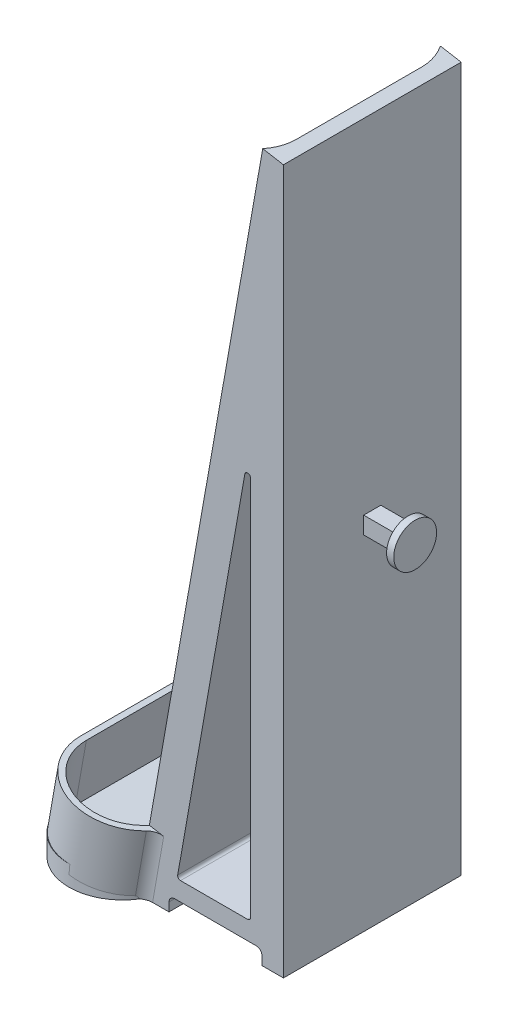
from build123d import *

# Parameters (mm, degrees)
BOSS_EXTRUDE1_DEPTH   = 3.175
BOSS_EXTRUDE2_START   = -3.175
BOSS_EXTRUDE2_DEPTH   = 11.112499999999999
BODY_MOVE_COPY2_ANGLE = 90.0000000000002
BOSS_EXTRUDE5_START   = -3.175
BOSS_EXTRUDE5_DEPTH   = 127
BOSS_EXTRUDE7_DEPTH   = 3.622257574
CUT_EXTRUDE1_START    = -11.112499999999999
CUT_EXTRUDE1_DEPTH    = 11.112499999999999
CUT_EXTRUDE4_REACH    = 131.332
LOFT1_START           = -15.77975
LOFT1_DEPTH           = 31.5595
CUT_EXTRUDE5_DEPTH    = 1.27
CUT_EXTRUDE6_DEPTH    = 133.79321580314624
FILLET2_R             = 0.508
CUT_EXTRUDE7_DEPTH    = 133.79321580314624
FILLET3_R             = 2.54
BOSS_EXTRUDE9_DEPTH   = 7.619999999999999
SKETCH20_R            = 3.81
BOSS_EXTRUDE10_DEPTH  = 1.27


with BuildPart() as part:
    # Sketch4 → Boss-Extrude1 (new body)
    with BuildSketch(Plane(origin=(0, 0, 0), x_dir=(0.984807753012208, -0.17364817766693072, 0), z_dir=(0.17364817766693072, 0.984807753012208, 0))):
        with BuildLine():
            Line((0, -8.731249999999998), (-22.225, -8.731249999999998))
            ThreePointArc((-22.225, -8.731249999999998), (-30.956249999999997, -1.63e-15), (-22.225000000000005, 8.73124999999999))
            Line((-22.225000000000005, 8.73124999999999), (1.71e-15, 8.73125))
            ThreePointArc((1.71e-15, 8.73125), (8.731249999999998, 0), (0, -8.731249999999998))
        make_face()
    extrude(amount=BOSS_EXTRUDE1_DEPTH)

    # Sketch5 → Boss-Extrude2 (add)
    with BuildSketch(Plane(origin=(0.5513329640925053, 3.1267646158137623, 0), x_dir=(0.9848077530122081, -0.17364817766693072, 0), z_dir=(0.17364817766693072, 0.9848077530122081, 0)).offset(BOSS_EXTRUDE2_START)):
        with BuildLine():
            Line((1.57e-15, 9.74725), (-22.225000000000005, 9.74724999999999))
            ThreePointArc((-22.225000000000005, 9.74724999999999), (-31.97225, -1.51e-15), (-22.225, -9.747249999999998))
            Line((-22.225, -9.747249999999998), (1.79e-15, -9.74725))
            ThreePointArc((1.79e-15, -9.74725), (9.74725, 2.16e-15), (1.57e-15, 9.74725))
        make_face()
        with BuildLine():
            Line((5.3e-16, 8.73125), (-22.225000000000005, 8.73124999999999))
            ThreePointArc((-22.225000000000005, 8.73124999999999), (-30.956249999999997, -1.63e-15), (-22.225000000000005, -8.731249999999998))
            Line((-22.225000000000005, -8.731249999999998), (-1.6e-15, -8.73125))
            ThreePointArc((-1.6e-15, -8.73125), (8.73125, -1.94e-15), (5.3e-16, 8.73125))
        make_face(mode=Mode.SUBTRACT)
    extrude(amount=BOSS_EXTRUDE2_DEPTH)


with BuildPart() as part_1:
    # Body-Move/Copy2: moved
    add(part.part.moved(Location((5e-17, 2.8e-16, 0))).rotate(Axis((-10.943676155348163, 1.9296653743237675, 1.73e-15), (0.1736481776669307, 0.984807753012208, 0)), BODY_MOVE_COPY2_ANGLE))

    # Sketch6 → Boss-Extrude5 (add)
    with BuildSketch(Plane(origin=(0.5513329640925054, 3.1267646158137636, -9e-17), x_dir=(0.9848077530122081, -0.1736481776669307, 0), z_dir=(0.1736481776669307, 0.9848077530122081, 0)).offset(BOSS_EXTRUDE5_START)):
        with BuildLine():
            Line((4.4e-16, 15.779750000000002), (-2.5553006918151486, 15.779750000000002))
            ThreePointArc((-2.5553006918151517, 15.77975), (-1.6674472336253352, 13.520790016359634), (-1.3652500000000423, 11.112500000000036))
            Line((-1.3652500000000418, 11.112500000000034), (-1.3652499999999672, -11.11250000000001))
            ThreePointArc((-1.3652499999999694, -11.112500000000013), (-1.667447233625257, -13.520790016359623), (-2.5553006918150736, -15.77975))
            Line((-2.555300691815072, -15.779750000000002), (4.49e-15, -15.779750000000002))
            Line((-1.1e-16, -15.77975), (-1.1e-16, 15.779750000000002))
        make_face()
        with BuildLine():
            ThreePointArc((-1.3652500000000423, 11.112500000000036), (-1.6674472336253352, 13.520790016359634), (-2.5553006918151517, 15.77975))
            Line((-2.5553006918151486, 15.779750000000002), (-3.733373764462396, 15.779750000000002))
            ThreePointArc((-3.7333737644623968, 15.77975), (-2.7260906817477455, 13.54208130327656), (-2.381250000000044, 11.11250000000003))
            Line((-2.3812500000000436, 11.112500000000027), (-2.381249999999966, -11.112499999999974))
            ThreePointArc((-2.3812499999999677, -11.112499999999974), (-2.7260906817476602, -13.542081303276534), (-3.7333737644623177, -15.779750000000003))
            Line((-3.7333737644623204, -15.779750000000002), (-2.555300691815072, -15.779750000000002))
            ThreePointArc((-2.5553006918150736, -15.77975), (-1.667447233625257, -13.520790016359623), (-1.3652499999999694, -11.112500000000013))
            Line((-1.3652499999999672, -11.11250000000001), (-1.3652500000000418, 11.112500000000034))
        make_face()
    extrude(amount=BOSS_EXTRUDE5_DEPTH)


with BuildPart() as boss_extrude7_tool:
    # Boss-Extrude7: read off the stored shape, not the designer's step
    # Boss-Extrude7 outline → Boss-Extrude7 (new body)
    with BuildSketch(Plane(origin=(0, 0, 0), x_dir=(1, 0, 0), z_dir=(0, 1, 0))):
        with BuildLine():
            Line((22.053318564, 15.77975), (-2.516479933, 15.77975))
            add(Edge.make_bspline(
                [(-2.516479933, 15.77975), (-6.087914144025663, 22.428833371813603), (-13.315378834961066, 20.557552766374705), (-20.54284352589647, 18.686272160935808), (-20.542843526, 11.1125)],
                knots=[2.070114834496927, 2.070114834496927, 2.070114834496927, 3.3912519074408096, 3.3912519074408096, 4.712388980384692, 4.712388980384692, 4.712388980384692], degree=2, weights=[1, 0.7896435245481747, 1, 0.7896435245481747, 1]))
            Line((-20.542843526, 11.1125), (-20.542843526, -11.1125))
            add(Edge.make_bspline(
                [(-20.542843526, -11.1125), (-20.542843525896345, -18.68627216093585), (-13.315378834960956, -20.557552766374716), (-6.08791414402557, -22.428833371813585), (-2.516479933, -15.77975)],
                knots=[4.712388980384692, 4.712388980384692, 4.712388980384692, 6.033526053328573, 6.033526053328573, 7.354663126272453, 7.354663126272453, 7.354663126272453], degree=2, weights=[1, 0.7896435245481753, 1, 0.7896435245481753, 1]))
            Line((-2.516479933, -15.77975), (22.053318564, -15.77975))
            Line((22.053318564, -15.77975), (22.053318564, 15.77975))
        make_face()
    extrude(amount=BOSS_EXTRUDE7_DEPTH)


with BuildPart() as part_2:
    add(part_1.part)


with BuildPart() as part_3:
    # Boss-Extrude7: joined with boss_extrude7_tool
    add(part_2.part.fuse(boss_extrude7_tool.part, tol=0.00001))

    # Sketch8 → Cut-Extrude1 (cut)
    with BuildSketch(Plane(origin=(1.929665374323769, 10.943676155348173, 0), x_dir=(0.9848077530122081, -0.17364817766693075, 0), z_dir=(0.17364817766693075, 0.9848077530122081, 0)).offset(CUT_EXTRUDE1_START)):
        with BuildLine():
            ThreePointArc((-3.7333737644623213, -15.779750000000003), (-3.2397646593705955, -14.88804828056871), (-2.853430222713813, -13.944900567790237))
            Line((-2.8534302227138113, -13.944900567790235), (-2.853430222713809, 13.94490056779))
            ThreePointArc((-2.8534302227138095, 13.94490056779), (-3.2397646593706177, 14.888048280568597), (-3.7333737644623985, 15.779750000000003))
            ThreePointArc((-3.7333737644623985, 15.779750000000003), (-13.542081303276605, 19.498909318252295), (-19.843750000000043, 11.112499999999972))
            Line((-19.843750000000046, 11.112499999999972), (-19.843749999999957, -11.112500000000043))
            ThreePointArc((-19.843749999999957, -11.112500000000042), (-13.54208130327649, -19.498909318252302), (-3.7333737644623213, -15.779750000000003))
        make_face()
    extrude(amount=CUT_EXTRUDE1_DEPTH, mode=Mode.SUBTRACT)

    # Sketch9 → Cut-Extrude4 (cut, up to next)
    with BuildSketch(Plane(origin=(0, 0, 0), x_dir=(0.9848077530122081, -0.17364817766693072, 0), z_dir=(0.17364817766693072, 0.9848077530122081, 0)), mode=Mode.PRIVATE) as cut_extrude4_sk1:
        with BuildLine():
            Line((-2.3812500000174737, -11.112499999999976), (-2.3812500000295542, 11.112500000000031))
            ThreePointArc((-2.3812500000295542, 11.112500000000031), (-2.500104004853256, 12.54824433126907), (-2.853430222713811, 13.944900567789999))
            Line((-2.853430222713811, 13.944900567789999), (-2.8534302227138113, -13.944900567790238))
            ThreePointArc((-2.8534302227138113, -13.944900567790238), (-2.500104004825662, -12.548244331273757), (-2.3812500000174737, -11.112499999999976))
        make_face()
    cut_extrude4_tool1 = extrude(cut_extrude4_sk1.sketch, amount=CUT_EXTRUDE4_REACH, mode=Mode.PRIVATE) & part_3.part
    add(cut_extrude4_tool1.solids().sort_by_distance((-2.584299, 0.455682, 0))[0], mode=Mode.SUBTRACT)

    # Loft1: read off the stored shape, not the designer's step
    # Loft1 outline → Loft1 (add)
    with BuildSketch(Plane.XY.offset(LOFT1_START)):
        Polygon((0.638701741, 3.622257574), (22.053318564, 3.622257574), (22.053318564, 125.070584633), align=None)
    extrude(amount=LOFT1_DEPTH)

    # Sketch12 → Cut-Extrude5 (cut)
    with BuildSketch(Plane(origin=(-2.345073461860326, 0.4134997230693797, 8.13e-15), x_dir=(3.36e-15, -5.9e-16, 1), z_dir=(-0.9848077530122081, 0.17364817766693072, 3.4134285390241548e-15))):
        with BuildLine():
            Line((-5.228221385273689, 114.22616766869933), (-0.12014507933680221, 114.22616766869933))
            add(Edge.make_bspline(
                [(-0.12014507933680221, 114.22616766869933), (0.07011968746962734, 114.22366909294938), (0.4411432164598798, 114.21879677524308), (0.9827741836600262, 114.17779062534875), (1.494126462329712, 114.10940638067792), (1.976272538251337, 114.0201107238905), (2.4258159831780612, 113.8958508526396), (2.846789640496429, 113.75076106159327), (3.2364123180406654, 113.57537489061744), (3.476580661151348, 113.43401615220935), (3.59407848992688, 113.36485905753871)],
                knots=[0, 0, 0, 0, 1.182376437119959, 2.305679005411862, 3.373202861573748, 4.38770938204811, 5.350376953479489, 6.268953384896463, 7.153118116444824, 8, 8, 8, 8], degree=3))
            add(Edge.make_bspline(
                [(3.59407848992688, 113.36485905753871), (3.7378787021642528, 113.26859900310113), (4.018252781224821, 113.08091621951313), (4.388442547868716, 112.74844804018409), (4.701416531623982, 112.38382962893776), (4.959695904779897, 111.98831066442631), (5.156117661939543, 111.55891716025648), (5.297432419351558, 111.1005637999526), (5.387891930540603, 110.61058984670753), (5.3965078564153615, 110.27234488132945), (5.400924630058811, 110.09895069597692)],
                knots=[0, 0, 0, 0, 1.0604796362436606, 2.067667333365926, 3.040862740220127, 4.0009023693274575, 4.955444635567215, 5.9271800263127785, 6.937412326837788, 8, 8, 8, 8], degree=3))
            add(Edge.make_bspline(
                [(5.400924630058811, 110.09895069597692), (5.397493058523768, 109.94376899276502), (5.3907923093439525, 109.64074932381718), (5.316867296627098, 109.20084612163079), (5.204149909546891, 108.78836521305224), (5.045292694282028, 108.40215934170175), (4.8378643415488884, 108.04538379924806), (4.583775694978403, 107.71622832331954), (4.287937265399445, 107.41091639148242), (4.058499321138568, 107.23855837370101), (3.9418624086289658, 107.15093857260379)],
                knots=[0, 0, 0, 0, 1.0854956756165175, 2.1196219236003433, 3.1134599711837283, 4.0743661896149845, 5.034707347550299, 5.993519082000086, 6.979986767058713, 8, 8, 8, 8], degree=3))
            add(Edge.make_bspline(
                [(3.9418624086289658, 107.15093857260379), (3.8674061020696757, 107.10088467302324), (3.7115153425793963, 106.99608575427958), (3.4527062359864646, 106.85561854380855), (3.1610901044496735, 106.72655205210827), (2.8385879725396244, 106.60485385068067), (2.486635569748659, 106.48730233965028), (2.1011619316461143, 106.38357058470808), (1.6861022595943742, 106.28087750946315), (1.3962794538586694, 106.22573847793748), (1.246537038687801, 106.19724985803789)],
                knots=[0, 0, 0, 0, 0.7474757140938376, 1.5650058692857316, 2.4502682500189836, 3.403591130996996, 4.437214553887347, 5.541548615613701, 6.729794755303424, 8, 8, 8, 8], degree=3))
            Line((1.246537038687801, 106.19724985803789), (1.246537038687801, 106.13475743514613))
            add(Edge.make_bspline(
                [(1.246537038687801, 106.13475743514613), (1.3660718402415537, 106.09071887952346), (1.6042519967499904, 106.00296945480137), (1.9468078176663832, 105.83231695525419), (2.272230351154713, 105.62779767822659), (2.5841780822657423, 105.39252783143037), (2.8810909309636, 105.12492533590407), (3.163673559657734, 104.82445574826548), (3.4344208083879644, 104.49333631807275), (3.596003402073053, 104.2523268186339), (3.6783074077375413, 104.12956577887941)],
                knots=[0, 0, 0, 0, 0.9509700540078693, 1.894864034191553, 2.852141104007893, 3.818150398457251, 4.809710567344614, 5.833759715287508, 6.896599883703487, 8, 8, 8, 8], degree=3))
            add(Edge.make_bspline(
                [(3.6783074077375413, 104.12956577887941), (3.775692600347029, 103.97408233985871), (3.979602254489536, 103.64852387017702), (4.2885028949926935, 103.13363510666991), (4.612027836066335, 102.56837441845246), (4.953795517003646, 101.9567395283279), (5.308731303043535, 101.29540349015345), (5.682472577026052, 100.58790380717947), (6.0694581075513865, 99.83080584339513), (6.331407875788347, 99.30876421533503), (6.466012881083948, 99.04050890599655)],
                knots=[0, 0, 0, 0, 0.7584941997821967, 1.5881704990499537, 2.482219144382332, 3.451093378059206, 4.484786460106584, 5.585221915356614, 6.759146766730135, 8, 8, 8, 8], degree=3))
            Line((6.466012881083948, 99.04050890599655), (4.346704626493113, 99.04050890599655))
            add(Edge.make_bspline(
                [(4.346704626493113, 99.04050890599655), (4.277356486192602, 99.20008226398323), (4.141116467962076, 99.51357700381334), (3.933941220184338, 99.97207322371179), (3.733535252246594, 100.41163643016142), (3.5386164470888235, 100.83086630514678), (3.34464723776627, 101.22755296425665), (3.1571473476643748, 101.60521553155496), (2.9764923498675473, 101.96418752150187), (2.7965282612002222, 102.3003469576902), (2.6228873824530443, 102.61713813313123), (2.4510721009562677, 102.91245986763002), (2.2873337607202027, 103.1890726898358), (2.124915748817319, 103.44382624931505), (1.9689717279499828, 103.6790023444885), (1.8167463558670436, 103.89373327881812), (1.670093961641272, 104.08855646111223), (1.5694830719355621, 104.20787414422202), (1.5209602870386663, 104.26541887212241)],
                knots=[0, 0, 0, 0, 1.4018530954257313, 2.7540535398598456, 4.053703774180958, 5.29423820197095, 6.478936837861934, 7.611353305162164, 8.691569836876138, 9.716620789310689, 10.683390878219486, 11.60209260650502, 12.46936221612508, 13.273055428587995, 14.03606427660493, 14.742693929439772, 15.393624366211194, 16, 16, 16, 16], degree=3))
            add(Edge.make_bspline(
                [(1.5209602870386663, 104.26541887212241), (1.4190542612158992, 104.37546577264021), (1.2174884622533795, 104.59313387663241), (0.8788604577850404, 104.87690606734962), (0.5137419428527865, 105.11421238931482), (0.1269062745209998, 105.31257173612752), (-0.28672510091762743, 105.46039470190755), (-0.722246339159558, 105.57045903530886), (-1.1832155194799538, 105.63649932804356), (-1.4992911336278083, 105.64437900547513), (-1.6607191567124484, 105.64840336133616)],
                knots=[0, 0, 0, 0, 1.0037135747502297, 1.9853029003006932, 2.9492317428411914, 3.914876407151171, 4.889583371749836, 5.883999607408954, 6.91930365731249, 8, 8, 8, 8], degree=3))
            Line((-1.6607191567124484, 105.64840336133616), (-3.5028871010875595, 105.64840336133616))
            Line((-3.5028871010875595, 105.64840336133616), (-3.5028871010875595, 99.04050890599655))
            Line((-3.5028871010875595, 99.04050890599655), (-5.228221385273689, 99.04050890599655))
            Line((-5.228221385273689, 99.04050890599655), (-5.228221385273689, 114.22616766869933))
        make_face()
        with BuildLine():
            Line((-3.5028871010875595, 112.77797369472893), (-3.5028871010875595, 107.04225609800937))
            Line((-3.5028871010875595, 107.04225609800937), (-0.7233328133357322, 107.04225609800937))
            add(Edge.make_bspline(
                [(-0.7233328133357322, 107.04225609800937), (-0.5656930761106643, 107.04431166122919), (-0.2582121559467261, 107.04832109743738), (0.1901043869444131, 107.0803068638523), (0.6119547944730254, 107.13734212129056), (1.0077513279490957, 107.21581100143905), (1.3784536567911683, 107.31591436722339), (1.7237653533404567, 107.43796621032233), (2.045583124079988, 107.58043717802614), (2.2420715093154806, 107.69865087593946), (2.338795908361539, 107.75684336846757)],
                knots=[0, 0, 0, 0, 1.1875963187305736, 2.316441370015899, 3.383740988879004, 4.3927372118522054, 5.354458331418604, 6.273829826032473, 7.1502664519934145, 8, 8, 8, 8], degree=3))
            add(Edge.make_bspline(
                [(2.338795908361539, 107.75684336846757), (2.4350413205497894, 107.82121345081156), (2.6230503163003602, 107.94695611493154), (2.8657662061494764, 108.17726563658894), (3.075236791541213, 108.42605034915319), (3.2486179112064186, 108.69920310543876), (3.378976840180573, 108.99852086119226), (3.4708248720680217, 109.32021673071652), (3.529833366333951, 109.66478330055456), (3.536374232403317, 109.90307243222955), (3.5397372526296795, 110.0255900256257)],
                knots=[0, 0, 0, 0, 1.0314879885760737, 2.014943013404641, 2.973070494454056, 3.9281942196848556, 4.890674066012517, 5.875290488997613, 6.907569581020537, 8, 8, 8, 8], degree=3))
            add(Edge.make_bspline(
                [(3.5397372526296795, 110.0255900256257), (3.536682182278085, 110.13717578609096), (3.5307676732467637, 110.3532019040146), (3.482949585730688, 110.66638265938118), (3.408721186406818, 110.9590567307924), (3.2986345508693007, 111.22972569904219), (3.159748412095904, 111.48014636365708), (2.986701905772532, 111.70696933816976), (2.78287508097514, 111.91178647481205), (2.551360345619989, 112.09893033374662), (2.2835855889430103, 112.25815799339519), (1.9885120908976983, 112.39976229175929), (1.6608122335584756, 112.51536914134584), (1.304538609403633, 112.61457480390641), (0.9157867847630289, 112.68450592338743), (0.4979422856846321, 112.73983224521153), (0.04881998571170654, 112.77217056247194), (-0.2613809106226743, 112.77599609144411), (-0.42173894633626763, 112.77797369472893)],
                knots=[0, 0, 0, 0, 0.9766163042266848, 1.8906949060826796, 2.7678355815559565, 3.6146226865584, 4.441911446639659, 5.268287420021439, 6.103859296954358, 6.967123262252878, 7.867510274299778, 8.825268696679245, 9.828724916005934, 10.906140664176334, 12.06024543163793, 13.283940868520185, 14.5959360132326, 16, 16, 16, 16], degree=3))
            Line((-0.42173894633626763, 112.77797369472893), (-3.5028871010875595, 112.77797369472893))
        make_face(mode=Mode.SUBTRACT)
    extrude(amount=-CUT_EXTRUDE5_DEPTH, mode=Mode.SUBTRACT)

    # Sketch13 → Cut-Extrude6 (cut, through all)
    with BuildSketch(Plane(origin=(-8e-17, -4.3e-16, -15.779750000000002), x_dir=(-1, 0, 0), z_dir=(0, -3e-17, -1))):
        Polygon((-5.020709493215531, 16.330763945263843), (-3.171257415384888, 5.842), (-4.367504164096216, 5.842), (-16.211318563640102, 5.842), (-16.211318563640102, 79.79586171686451), align=None)
    extrude(amount=-CUT_EXTRUDE6_DEPTH, mode=Mode.SUBTRACT)

    # Fillet2
    fillet2_edges = [part_3.edges().sort_by_distance(p)[0] for p in [
        (3.171257415384888, 5.842, -1.78e-15),
        (16.211318563640102, 5.842, -1.78e-15),
        (16.211318563640102, 79.79586171686451, -1.78e-15),
    ]]
    fillet(fillet2_edges, radius=FILLET2_R)

    # Sketch15 → Cut-Extrude7 (cut, through all)
    with BuildSketch(Plane.XY.offset(15.779750000000002)):
        with BuildLine():
            Line((18.243318563640102, -4.3e-16), (1.733318563640101, -2.45e-15))
            Line((1.733318563640101, -2.45e-15), (1.733318563640101, 1.5239999999999905))
            ThreePointArc((1.733318563640101, 1.5239999999999905), (2.0308980739545683, 2.24242048968553), (2.7493185636401076, 2.5399999999999974))
            Line((2.7493185636401076, 2.5399999999999974), (17.227318563640093, 2.5399999999999996))
            ThreePointArc((17.227318563640093, 2.5399999999999996), (17.945739053325635, 2.242420489685533), (18.243318563640102, 1.5239999999999927))
            Line((18.243318563640102, 1.5239999999999927), (18.243318563640102, -4.3e-16))
        make_face()
    extrude(amount=-CUT_EXTRUDE7_DEPTH, mode=Mode.SUBTRACT)

    # Fillet3
    fillet3_edges = [part_3.edges().sort_by_distance(p)[0] for p in [
        (-1.5516472454151984, 5.915561386198842, -15.779750000000057),
        (-1.5516472454151131, 5.915561386198828, 15.779750000000059),
    ]]
    fillet(fillet3_edges, radius=FILLET3_R)

    # Sketch18 → Boss-Extrude9 (add)
    with BuildSketch(Plane(origin=(22.0533185636401, 0, 0), x_dir=(0, 0, -1), z_dir=(1, 0, 0))):
        Polygon((-1.5240000000000167, 64.05929231628052), (1.5239999999999834, 64.05929231628052), (1.5239999999999836, 61.01129231628052), (-1.5240000000000162, 61.01129231628052), align=None)
    extrude(amount=BOSS_EXTRUDE9_DEPTH)

    # Sketch20 → Boss-Extrude10 (add)
    with BuildSketch(Plane(origin=(29.673318563640102, 0, 0), x_dir=(0, 0, -1), z_dir=(1, 0, 0))):
        with Locations((2.2e-16, 62.53529231628052)):
            Circle(SKETCH20_R)
        Polygon((1.5239999999999836, 61.01129231628052), (1.5239999999999834, 64.05929231628052), (-1.5240000000000167, 64.05929231628052), (-1.5240000000000162, 61.01129231628052), align=None, mode=Mode.SUBTRACT)
    extrude(amount=-BOSS_EXTRUDE10_DEPTH)


solid = part_3.part
